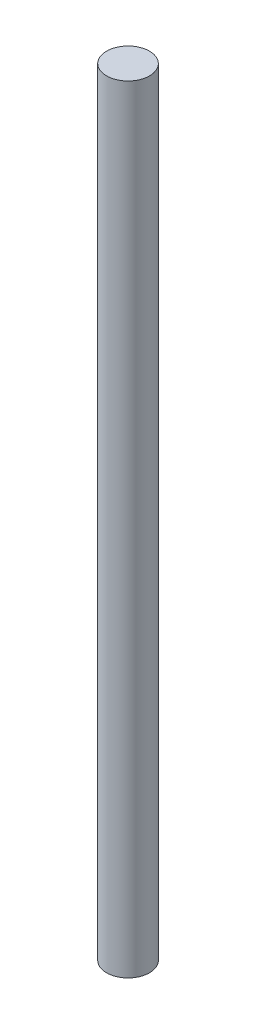
from build123d import *

# Parameters (mm, degrees)
SKETCH_1_R      = 1
EXTRUDE_1_DEPTH = 36.2


with BuildPart() as part:
    # 草图1 → 凸台-拉伸1 (new body)
    with BuildSketch(Plane(origin=(0, 0, 0), x_dir=(1, 0, 0), z_dir=(0, 1, 0))):
        Circle(SKETCH_1_R)
    extrude(amount=EXTRUDE_1_DEPTH)


solid = part.part
